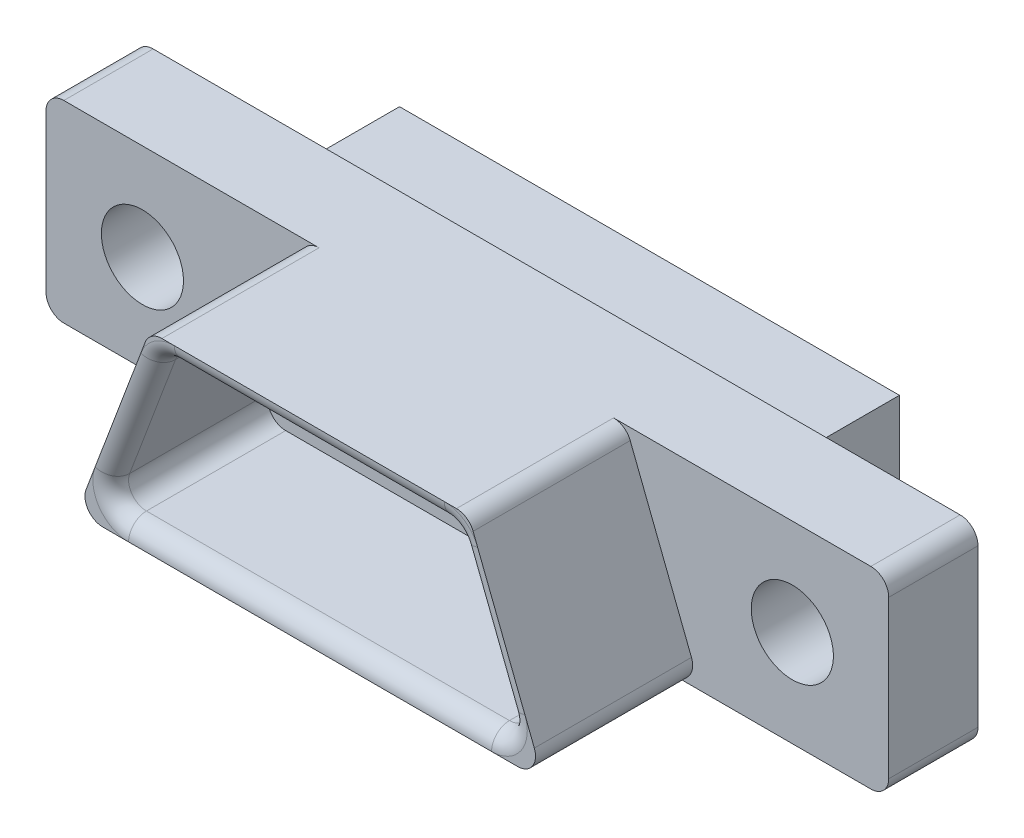
from build123d import *

# Parameters (mm, degrees)
SKETCH_1_W          = 23.6
SKETCH_1_H          = 5.4
SKETCH_1_R          = 1.15
EXTRUDE_1_DEPTH     = 2.5
FILLET_1_R          = 0.5
FILLET_2_R          = 0.5
SKETCH_3_W          = 14
SKETCH_3_H          = 4.3
EXTRUDE_2_DEPTH     = 2.6
SKETCH_4_R          = 0.31
CUT_EXTRUDE_1_DEPTH = 4.5
EXTRUDE_3_DEPTH     = 4.4
FILLET_3_R          = 0.5


with BuildPart() as part:
    # 草图1 → 凸台-拉伸1 (new body)
    with BuildSketch(Plane.XY):
        Rectangle(SKETCH_1_W, SKETCH_1_H)
        with Locations((-9.1, 0)):
            Circle(SKETCH_1_R, mode=Mode.SUBTRACT)
        with Locations(Location((9.1, 0, 0), (0, 0, 180))):
            Circle(SKETCH_1_R, mode=Mode.SUBTRACT)
    extrude(amount=EXTRUDE_1_DEPTH)

    # 圆角1
    fillet_1_edges = [part.edges().sort_by_distance(p)[0] for p in [
        (-11.8, 2.7, 1.25),
    ]]
    fillet(fillet_1_edges, radius=FILLET_1_R)

    # 圆角2
    fillet_2_edges = [part.edges().sort_by_distance(p)[0] for p in [
        (11.8, 2.7, 1.25),
        (11.8, -2.7, 1.25),
        (-11.8, -2.7, 1.25),
    ]]
    fillet(fillet_2_edges, radius=FILLET_2_R)

    # 草图3 → 凸台-拉伸2 (add)
    with BuildSketch(Plane(origin=(0, 0, 0), x_dir=(-1, 0, 0), z_dir=(0, 0, -1))):
        Rectangle(SKETCH_3_W, SKETCH_3_H)
    extrude(amount=EXTRUDE_2_DEPTH)

    # 草图4 → 切除-拉伸1 (cut)
    with BuildSketch(Plane(origin=(0, 0, -2.6), x_dir=(-1, 0, 0), z_dir=(0, 0, -1))):
        with Locations((0, 0.55)):
            Circle(SKETCH_4_R)
        with Locations((1.27, 0.55)):
            Circle(SKETCH_4_R)
        with Locations((2.54, 0.55)):
            Circle(SKETCH_4_R)
        with Locations((3.81, 0.55)):
            Circle(SKETCH_4_R)
        with Locations(Location((-3.81, 0.55, 0), (0, 0, 180))):
            Circle(SKETCH_4_R)
        with Locations(Location((-2.54, 0.55, 0), (0, 0, 180))):
            Circle(SKETCH_4_R)
        with Locations(Location((-1.27, 0.55, 0), (0, 0, 180))):
            Circle(SKETCH_4_R)
        with Locations(Location((-4.445, -0.55, 0), (0, 0, 180))):
            Circle(SKETCH_4_R)
        with Locations(Location((-3.175, -0.55, 0), (0, 0, 180))):
            Circle(SKETCH_4_R)
        with Locations(Location((-1.905, -0.55, 0), (0, 0, 180))):
            Circle(SKETCH_4_R)
        with Locations(Location((-0.635, -0.55, 0), (0, 0, 180))):
            Circle(SKETCH_4_R)
        with Locations(Location((0.635, -0.55, 0), (0, 0, 180))):
            Circle(SKETCH_4_R)
        with Locations(Location((1.905, -0.55, 0), (0, 0, 180))):
            Circle(SKETCH_4_R)
        with Locations(Location((3.175, -0.55, 0), (0, 0, 180))):
            Circle(SKETCH_4_R)
        with Locations(Location((4.445, -0.55, 0), (0, 0, 180))):
            Circle(SKETCH_4_R)
    extrude(amount=-CUT_EXTRUDE_1_DEPTH, mode=Mode.SUBTRACT)

    # 草图5 → 凸台-拉伸3 (add)
    with BuildSketch(Plane.XY.offset(2.5)):
        with BuildLine():
            Line((-4.153912025, 2.7), (4.094589559, 2.7))
            ThreePointArc((4.094589559, 2.7), (4.376736154, 2.612787232), (4.560455607, 2.381573196))
            Line((4.560455607, 2.381573196), (6.275373584, -2.018426804))
            ThreePointArc((6.275373584, -2.018426804), (6.222294768, -2.482146595), (5.809507536, -2.7))
            Line((5.809507536, -2.7), (-5.809507536, -2.7))
            ThreePointArc((-5.809507536, -2.7), (-6.220628978, -2.484568375), (-6.277476178, -2.02391664))
            Line((-6.277476178, -2.02391664), (-4.621880667, 2.37608336))
            ThreePointArc((-4.621880667, 2.37608336), (-4.4384804, 2.611121442), (-4.153912025, 2.7))
        make_face()
        with BuildLine():
            Line((-3.807824049, 2.2), (3.752831659, 2.2))
            ThreePointArc((3.752831659, 2.2), (4.034978254, 2.112787232), (4.218697707, 1.881573196))
            Line((4.218697707, 1.881573196), (5.543861598, -1.518426804))
            ThreePointArc((5.543861598, -1.518426804), (5.490782782, -1.982146595), (5.07799555, -2.2))
            Line((5.07799555, -2.2), (-5.087147854, -2.2))
            ThreePointArc((-5.087147854, -2.2), (-5.498269295, -1.984568375), (-5.555116496, -1.52391664))
            Line((-5.555116496, -1.52391664), (-4.275792692, 1.87608336))
            ThreePointArc((-4.275792692, 1.87608336), (-4.092392424, 2.111121442), (-3.807824049, 2.2))
        make_face(mode=Mode.SUBTRACT)
    extrude(amount=EXTRUDE_3_DEPTH)

    # 圆角3
    fillet_3_edges = [part.edges().sort_by_distance(p)[0] for p in [
        (5.490782782, -1.982146595, 6.9),
        (4.881279653, 0.181573196, 6.9),
        (4.034978254, 2.112787232, 6.9),
        (-0.027496195, 2.2, 6.9),
        (-4.092392424, 2.111121442, 6.9),
        (-4.915454594, 0.17608336, 6.9),
        (-5.498269295, -1.984568375, 6.9),
        (-0.004576152, -2.2, 6.9),
    ]]
    fillet(fillet_3_edges, radius=FILLET_3_R - 0.0001)  # a hair under: the kernel refuses the full size


solid = part.part
